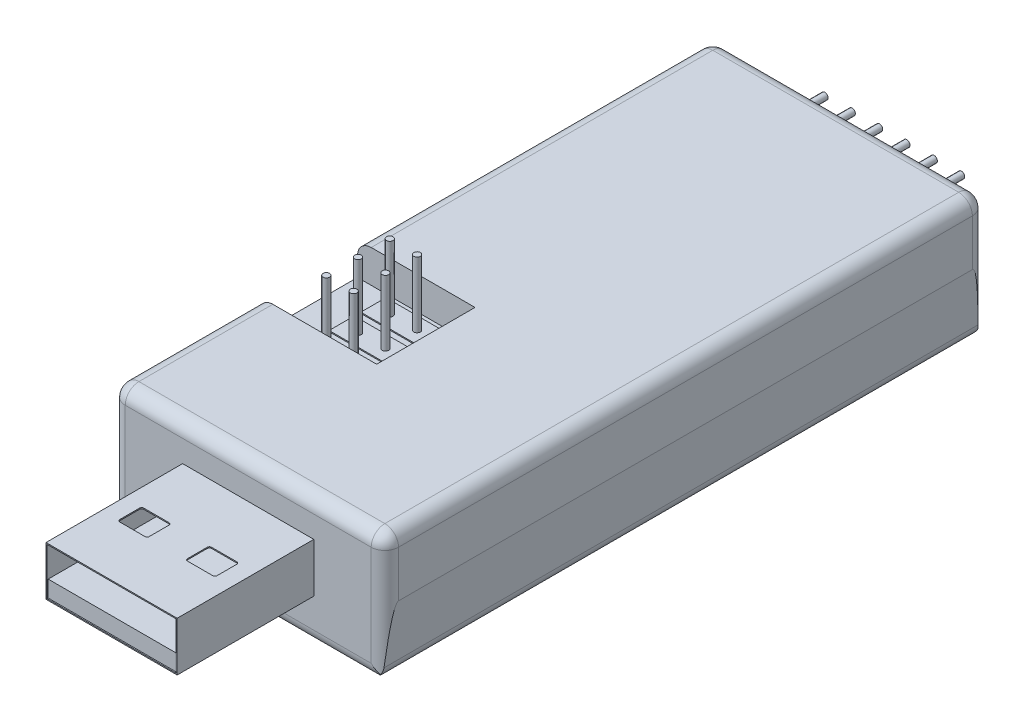
from build123d import *

# Parameters (mm, degrees)
BOSS_EXTRUDE1_DEPTH = 55
SKETCH2_W           = 12
SKETCH2_H           = 4.5
SKETCH2_W_2         = 11.8
SKETCH2_H_2         = 4.3
BOSS_EXTRUDE2_DEPTH = 12.5
SKETCH3_W           = 11.8
SKETCH3_H           = 1.5
BOSS_EXTRUDE3_DEPTH = 12.4
CUT_EXTRUDE1_DEPTH  = 0.5
SKETCH6_W           = 10.75
SKETCH6_H           = 9
CUT_EXTRUDE2_DEPTH  = 3
SKETCH7_W           = 5.5
SKETCH7_H           = 2.3
BOSS_EXTRUDE4_DEPTH = 0.1
SKETCH8_R           = 0.3
BOSS_EXTRUDE5_DEPTH = 6
LPATTERN1_COUNT     = 3
LPATTERN1_PITCH     = 2.9
SKETCH9_W           = 15.5
SKETCH9_H           = 3.5
CUT_EXTRUDE3_DEPTH  = 2
SKETCH10_R          = 0.3
BOSS_EXTRUDE6_DEPTH = 6
LPATTERN2_COUNT     = 6
LPATTERN2_PITCH     = 2.5
FILLET1_R           = 1.25


with BuildPart() as part:
    # Sketch1 → Boss-Extrude1 (new body)
    with BuildSketch(Plane.XY):
        Polygon((-12.5, 0), (-12, -6.2), (12, -6.2), (12.5, 0), (12.5, 5.5), (-12.5, 5.5), align=None)
    extrude(amount=-BOSS_EXTRUDE1_DEPTH)

    # Sketch2 → Boss-Extrude2 (add)
    with BuildSketch(Plane.XY):
        Rectangle(SKETCH2_W, SKETCH2_H)
        Rectangle(SKETCH2_W_2, SKETCH2_H_2, mode=Mode.SUBTRACT)
    extrude(amount=BOSS_EXTRUDE2_DEPTH)

    # Sketch3 → Boss-Extrude3 (add)
    with BuildSketch(Plane.XY):
        with Locations((0, -1.4)):
            Rectangle(SKETCH3_W, SKETCH3_H)
    extrude(amount=BOSS_EXTRUDE3_DEPTH)

    # Sketch4 → Cut-Extrude1 (cut)
    with BuildSketch(Plane(origin=(0, 2.25, 0), x_dir=(1, 0, 0), z_dir=(0, 1, 0))):
        with BuildLine():
            Line((-4.25, -5.3), (-1.95, -5.3))
            ThreePointArc((-1.95, -5.3), (-1.808578644, -5.358578644), (-1.75, -5.5))
            Line((-1.75, -5.5), (-1.75, -7.3))
            ThreePointArc((-1.75, -7.3), (-1.808578644, -7.441421356), (-1.95, -7.5))
            Line((-1.95, -7.5), (-4.25, -7.5))
            ThreePointArc((-4.25, -7.5), (-4.391421356, -7.441421356), (-4.45, -7.3))
            Line((-4.45, -7.3), (-4.45, -5.5))
            ThreePointArc((-4.45, -5.5), (-4.391421356, -5.358578644), (-4.25, -5.3))
        make_face()
        with BuildLine():
            Line((1.95, -5.3), (4.25, -5.3))
            ThreePointArc((4.25, -5.3), (4.391421356, -5.358578644), (4.45, -5.5))
            Line((4.45, -5.5), (4.45, -7.3))
            ThreePointArc((4.45, -7.3), (4.391421356, -7.441421356), (4.25, -7.5))
            Line((4.25, -7.5), (1.95, -7.5))
            ThreePointArc((1.95, -7.5), (1.808578644, -7.441421356), (1.75, -7.3))
            Line((1.75, -7.3), (1.75, -5.5))
            ThreePointArc((1.75, -5.5), (1.808578644, -5.358578644), (1.95, -5.3))
        make_face()
    extrude(amount=-CUT_EXTRUDE1_DEPTH, mode=Mode.SUBTRACT)

    # Sketch6 → Cut-Extrude2 (cut)
    with BuildSketch(Plane(origin=(0, 5.5, 0), x_dir=(1, 0, 0), z_dir=(0, 1, 0))):
        with Locations((-7.125, 18)):
            Rectangle(SKETCH6_W, SKETCH6_H)
    extrude(amount=-CUT_EXTRUDE2_DEPTH, mode=Mode.SUBTRACT)

    # Sketch7 → Boss-Extrude4 (add)
    with BuildSketch(Plane(origin=(0, 2.5, 0), x_dir=(1, 0, 0), z_dir=(0, 1, 0))):
        with Locations((-6.75, 15.15)):
            Rectangle(SKETCH7_W, SKETCH7_H)
    boss_extrude4 = extrude(amount=BOSS_EXTRUDE4_DEPTH)

    # Sketch8 → Boss-Extrude5 (add)
    with BuildSketch(Plane(origin=(0, 2.6, 0), x_dir=(1, 0, 0), z_dir=(0, 1, 0))):
        with Locations(Location((-8, 15.15, 0), (0, 0, 180))):
            Circle(SKETCH8_R)
        with Locations(Location((-5.5, 15.15, 0), (0, 0, 180))):
            Circle(SKETCH8_R)
    boss_extrude5 = extrude(amount=BOSS_EXTRUDE5_DEPTH)

    # LPattern1: Boss-Extrude4, Boss-Extrude5 ×3
    with Locations(*[(0, 0, -i * LPATTERN1_PITCH) for i in range(1, LPATTERN1_COUNT)]):
        add(boss_extrude4)
        add(boss_extrude5)

    # Sketch9 → Cut-Extrude3 (cut)
    with BuildSketch(Plane(origin=(0, 0, -55), x_dir=(-1, 0, 0), z_dir=(0, 0, -1))):
        with Locations((0, 1.75)):
            Rectangle(SKETCH9_W, SKETCH9_H)
    extrude(amount=-CUT_EXTRUDE3_DEPTH, mode=Mode.SUBTRACT)

    # Sketch10 → Boss-Extrude6 (add)
    with BuildSketch(Plane(origin=(0, 0, -53), x_dir=(-1, 0, 0), z_dir=(0, 0, -1))):
        with Locations((-6.25, 1.75)):
            Circle(SKETCH10_R)
    boss_extrude6 = extrude(amount=BOSS_EXTRUDE6_DEPTH)

    # LPattern2: Boss-Extrude6 ×6
    with Locations(*[(-i * LPATTERN2_PITCH, 0, 0) for i in range(1, LPATTERN2_COUNT)]):
        add(boss_extrude6)

    # Fillet1
    # the kernel refuses this fillet: 1.25 mm, written as the material it takes off along each edge
    with BuildSketch(Plane(origin=(11.25, 4.25, -1.25), x_dir=(0, 0, 1), z_dir=(1, 0, 0))) as fillet1_piece_1_section:
        Polygon((0, 0), (FILLET1_R * 1.02, 0), (FILLET1_R * 1.02, -FILLET1_R * 1.02), (0, -FILLET1_R * 1.02), align=None)
    fillet1_piece_1 = extrude(amount=FILLET1_R * 1.02, mode=Mode.PRIVATE)
    fillet1_piece_1 = fillet1_piece_1 - Plane(origin=(11.25, 4.25, -1.25), x_dir=(0, -0.7071067811865475, -0.7071067811865475), z_dir=(1, 0, 0)) * Sphere(FILLET1_R, mode=Mode.PRIVATE)
    add(fillet1_piece_1, mode=Mode.SUBTRACT)
    with BuildSketch(Plane(origin=(-11.25, 4.25, -1.25), x_dir=(0, 0, 1), z_dir=(-1, 0, 0))) as fillet1_piece_2_section:
        Polygon((0, 0), (FILLET1_R * 1.02, 0), (FILLET1_R * 1.02, FILLET1_R * 1.02), (0, FILLET1_R * 1.02), align=None)
    fillet1_piece_2 = extrude(amount=FILLET1_R * 1.02, mode=Mode.PRIVATE)
    fillet1_piece_2 = fillet1_piece_2 - Plane(origin=(-11.25, 4.25, -1.25), x_dir=(0, -0.7071067811865475, -0.7071067811865475), z_dir=(-1, 0, 0)) * Sphere(FILLET1_R, mode=Mode.PRIVATE)
    add(fillet1_piece_2, mode=Mode.SUBTRACT)
    with BuildSketch(Plane(origin=(-11.25, 4.25, -53.75), x_dir=(0, 0, -1), z_dir=(-1, 0, 0))) as fillet1_piece_3_section:
        Polygon((0, 0), (FILLET1_R * 1.02, 0), (FILLET1_R * 1.02, -FILLET1_R * 1.02), (0, -FILLET1_R * 1.02), align=None)
    fillet1_piece_3 = extrude(amount=FILLET1_R * 1.02, mode=Mode.PRIVATE)
    fillet1_piece_3 = fillet1_piece_3 - Plane(origin=(-11.25, 4.25, -53.75), x_dir=(0, -0.7071067811865475, 0.7071067811865475), z_dir=(-1, 0, 0)) * Sphere(FILLET1_R, mode=Mode.PRIVATE)
    add(fillet1_piece_3, mode=Mode.SUBTRACT)
    with BuildSketch(Plane(origin=(11.25, 4.25, -53.75), x_dir=(0, 0, -1), z_dir=(1, 0, 0))) as fillet1_piece_4_section:
        Polygon((0, 0), (FILLET1_R * 1.02, 0), (FILLET1_R * 1.02, FILLET1_R * 1.02), (0, FILLET1_R * 1.02), align=None)
    fillet1_piece_4 = extrude(amount=FILLET1_R * 1.02, mode=Mode.PRIVATE)
    fillet1_piece_4 = fillet1_piece_4 - Plane(origin=(11.25, 4.25, -53.75), x_dir=(0, -0.7071067811865475, 0.7071067811865475), z_dir=(1, 0, 0)) * Sphere(FILLET1_R, mode=Mode.PRIVATE)
    add(fillet1_piece_4, mode=Mode.SUBTRACT)
    with BuildSketch(Plane(origin=(-19.5, -6.2, 0), x_dir=(0, 0, -1), z_dir=(1, 0, 0))) as fillet1_piece_5:
        with BuildLine():
            CenterArc((FILLET1_R, FILLET1_R), FILLET1_R, 180, 90)
            Line((0, FILLET1_R), (-FILLET1_R * 0.02, FILLET1_R))
            Line((-FILLET1_R * 0.02, FILLET1_R), (-FILLET1_R * 0.02, -FILLET1_R * 0.02))
            Line((-FILLET1_R * 0.02, -FILLET1_R * 0.02), (FILLET1_R, -FILLET1_R * 0.02))
            Line((FILLET1_R, -FILLET1_R * 0.02), (FILLET1_R, 0))
        make_face()
    extrude(amount=39, mode=Mode.SUBTRACT)
    with BuildSketch(Plane(origin=(11.25, 5.5, 0), x_dir=(0, -1, 0), z_dir=(-1, 0, 0))) as fillet1_piece_6:
        with BuildLine():
            CenterArc((FILLET1_R, -FILLET1_R), FILLET1_R, 90, 90)
            Line((0, -FILLET1_R), (-FILLET1_R * 0.02, -FILLET1_R))
            Line((-FILLET1_R * 0.02, -FILLET1_R), (-FILLET1_R * 0.02, FILLET1_R * 0.02))
            Line((-FILLET1_R * 0.02, FILLET1_R * 0.02), (FILLET1_R, FILLET1_R * 0.02))
            Line((FILLET1_R, FILLET1_R * 0.02), (FILLET1_R, 0))
        make_face()
    extrude(amount=22.5, mode=Mode.SUBTRACT)
    with BuildSketch(Plane(origin=(-12.5, 5.5, -1.25), x_dir=(0, -1, 0), z_dir=(0, 0, -1))) as fillet1_piece_7:
        with BuildLine():
            CenterArc((FILLET1_R, -FILLET1_R), FILLET1_R, 90, 90)
            Line((0, -FILLET1_R), (-FILLET1_R * 0.02, -FILLET1_R))
            Line((-FILLET1_R * 0.02, -FILLET1_R), (-FILLET1_R * 0.02, FILLET1_R * 0.02))
            Line((-FILLET1_R * 0.02, FILLET1_R * 0.02), (FILLET1_R, FILLET1_R * 0.02))
            Line((FILLET1_R, FILLET1_R * 0.02), (FILLET1_R, 0))
        make_face()
    extrude(amount=19.75, mode=Mode.SUBTRACT)
    with BuildSketch(Plane(origin=(-12.5, 5.5, -15), x_dir=(0, -1, 0), z_dir=(0, 0, -1))) as fillet1_piece_8:
        with BuildLine():
            CenterArc((FILLET1_R, -FILLET1_R), FILLET1_R, 90, 90)
            Line((0, -FILLET1_R), (-FILLET1_R * 0.02, -FILLET1_R))
            Line((-FILLET1_R * 0.02, -FILLET1_R), (-FILLET1_R * 0.02, FILLET1_R * 0.02))
            Line((-FILLET1_R * 0.02, FILLET1_R * 0.02), (FILLET1_R, FILLET1_R * 0.02))
            Line((FILLET1_R, FILLET1_R * 0.02), (FILLET1_R, 0))
        make_face()
    extrude(amount=38.75, mode=Mode.SUBTRACT)
    with BuildSketch(Plane(origin=(-12, -6.2, 6.919510423), x_dir=(-0.08038418992031013, 0.9967639550118451, 0), z_dir=(0, 0, -1)), Plane(origin=(12, -6.2, 6.919510423), x_dir=(-1, 0, 0), z_dir=(0, 0, -1))) as fillet1_piece_9:
        with BuildLine():
            CenterArc((FILLET1_R * 0.922601389683, FILLET1_R), FILLET1_R, 184.610649319, 85.389350681)
            Line((-FILLET1_R * 0.074162565329, FILLET1_R * 0.91961581008), (-FILLET1_R * 0.0940978444292, FILLET1_R * 0.918008126281))
            Line((-FILLET1_R * 0.0940978444292, FILLET1_R * 0.918008126281), (-FILLET1_R * 0.0184520277937, -FILLET1_R * 0.02))
            Line((-FILLET1_R * 0.0184520277937, -FILLET1_R * 0.02), (FILLET1_R * 0.922601389683, -FILLET1_R * 0.02))
            Line((FILLET1_R * 0.922601389683, -FILLET1_R * 0.02), (FILLET1_R * 0.922601389683, 0))
        make_face()
    extrude(amount=68.839020845, mode=Mode.SUBTRACT)
    with BuildSketch(Plane(origin=(-19.5, -6.2, -55), x_dir=(0, 0, 1), z_dir=(1, 0, 0))) as fillet1_piece_10:
        with BuildLine():
            CenterArc((FILLET1_R, -FILLET1_R), FILLET1_R, 90, 90)
            Line((0, -FILLET1_R), (-FILLET1_R * 0.02, -FILLET1_R))
            Line((-FILLET1_R * 0.02, -FILLET1_R), (-FILLET1_R * 0.02, FILLET1_R * 0.02))
            Line((-FILLET1_R * 0.02, FILLET1_R * 0.02), (FILLET1_R, FILLET1_R * 0.02))
            Line((FILLET1_R, FILLET1_R * 0.02), (FILLET1_R, 0))
        make_face()
    extrude(amount=39, mode=Mode.SUBTRACT)
    with BuildSketch(Plane(origin=(11.25, 5.5, -55), x_dir=(0, -1, 0), z_dir=(-1, 0, 0))) as fillet1_piece_11:
        with BuildLine():
            CenterArc((FILLET1_R, FILLET1_R), FILLET1_R, 180, 90)
            Line((0, FILLET1_R), (-FILLET1_R * 0.02, FILLET1_R))
            Line((-FILLET1_R * 0.02, FILLET1_R), (-FILLET1_R * 0.02, -FILLET1_R * 0.02))
            Line((-FILLET1_R * 0.02, -FILLET1_R * 0.02), (FILLET1_R, -FILLET1_R * 0.02))
            Line((FILLET1_R, -FILLET1_R * 0.02), (FILLET1_R, 0))
        make_face()
    extrude(amount=22.5, mode=Mode.SUBTRACT)
    with BuildSketch(Plane(origin=(12.5, 5.5, -1.25), x_dir=(-1, 0, 0), z_dir=(0, 0, -1))) as fillet1_piece_12:
        with BuildLine():
            CenterArc((FILLET1_R, -FILLET1_R), FILLET1_R, 90, 90)
            Line((0, -FILLET1_R), (-FILLET1_R * 0.02, -FILLET1_R))
            Line((-FILLET1_R * 0.02, -FILLET1_R), (-FILLET1_R * 0.02, FILLET1_R * 0.02))
            Line((-FILLET1_R * 0.02, FILLET1_R * 0.02), (FILLET1_R, FILLET1_R * 0.02))
            Line((FILLET1_R, FILLET1_R * 0.02), (FILLET1_R, 0))
        make_face()
    extrude(amount=52.5, mode=Mode.SUBTRACT)
    with BuildSketch(Plane(origin=(12.5, -7.5, -55), x_dir=(-1, 0, 0), z_dir=(0, 1, 0)), Plane(origin=(-12.5, 4.25, 0), x_dir=(0, 0, -1), z_dir=(0, -1, 0))) as fillet1_piece_13:
        with BuildLine():
            CenterArc((FILLET1_R, FILLET1_R), FILLET1_R, 180, 90)
            Line((0, FILLET1_R), (-FILLET1_R * 0.02, FILLET1_R))
            Line((-FILLET1_R * 0.02, FILLET1_R), (-FILLET1_R * 0.02, -FILLET1_R * 0.02))
            Line((-FILLET1_R * 0.02, -FILLET1_R * 0.02), (FILLET1_R, -FILLET1_R * 0.02))
            Line((FILLET1_R, -FILLET1_R * 0.02), (FILLET1_R, 0))
        make_face()
    extrude(amount=11.75, mode=Mode.SUBTRACT)
    with BuildSketch(Plane(origin=(-12.5, 4.25, -55), x_dir=(0, 0, 1), z_dir=(0, -1, 0)), Plane(origin=(12.5, -7.5, 0), x_dir=(-1, 0, 0), z_dir=(0, 1, 0))) as fillet1_piece_14:
        with BuildLine():
            CenterArc((FILLET1_R, -FILLET1_R), FILLET1_R, 90, 90)
            Line((0, -FILLET1_R), (-FILLET1_R * 0.02, -FILLET1_R))
            Line((-FILLET1_R * 0.02, -FILLET1_R), (-FILLET1_R * 0.02, FILLET1_R * 0.02))
            Line((-FILLET1_R * 0.02, FILLET1_R * 0.02), (FILLET1_R, FILLET1_R * 0.02))
            Line((FILLET1_R, FILLET1_R * 0.02), (FILLET1_R, 0))
        make_face()
    extrude(amount=11.75, mode=Mode.SUBTRACT)


solid = part.part
